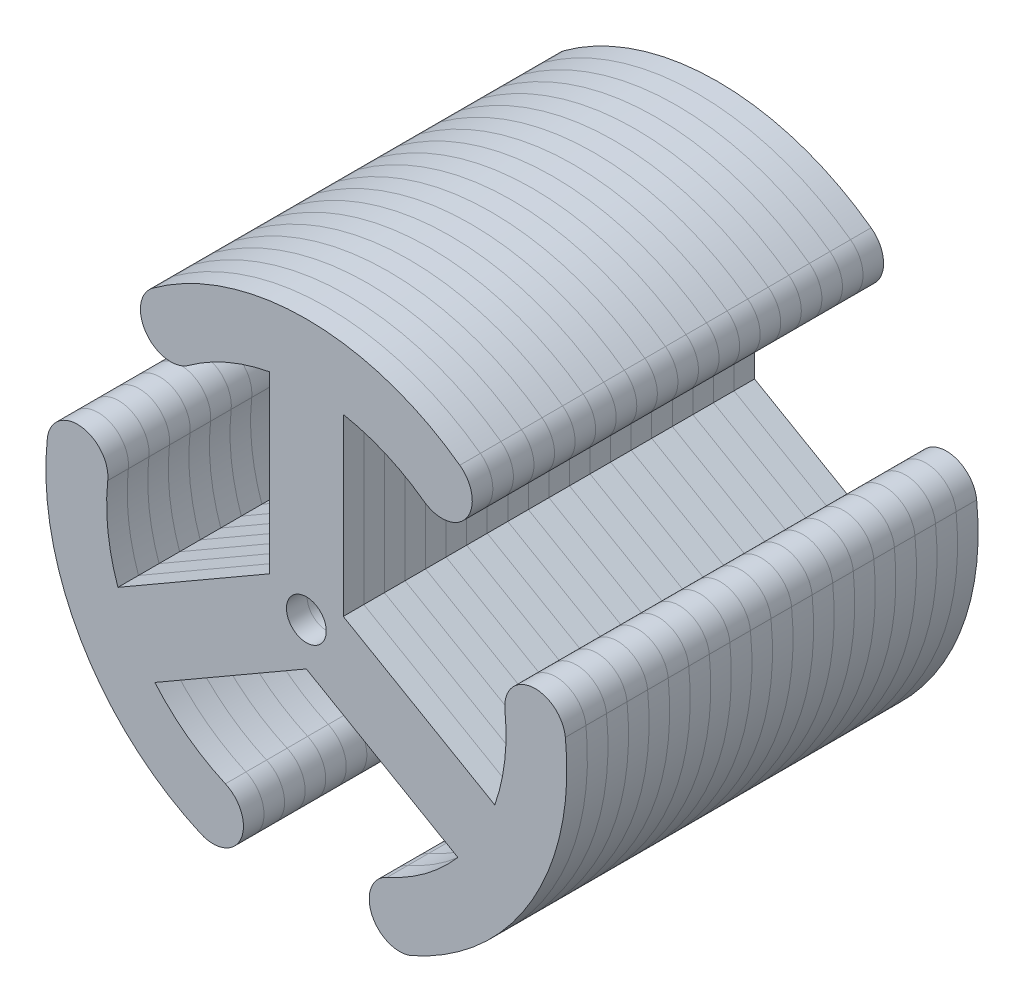
from build123d import *

# Parameters (mm, degrees)
BOSS_EXTRUDE3_DEPTH = 1.5
CIRPATTERN1_COUNT   = 3
LPATTERN1_COUNT     = 20
LPATTERN1_PITCH     = 1.5
SKETCH6_R           = 1.45
CUT_EXTRUDE1_DEPTH  = 31.5


with BuildPart() as part:
    # Sketch2 → Boss-Extrude3 (new body)
    with BuildSketch(Plane.XY):
        with BuildLine():
            ThreePointArc((-11.191746167, 15.353983774), (-11.677300028, 12.257240413), (-8.580556666, 11.771686551))
            ThreePointArc((-8.580556666, 11.771686551), (-5.778042889, 13.37208949), (-2.691924581, 14.31614819))
            Line((-2.691924581, 14.31614819), (-2.691924581, 0))
            Line((-2.691924581, 0), (2.691924581, 0))
            Line((2.691924581, 0), (2.691924581, 14.31614819))
            ThreePointArc((2.691924581, 14.31614819), (5.778042889, 13.37208949), (8.580556666, 11.771686551))
            ThreePointArc((8.580556666, 11.771686551), (11.677300028, 12.257240413), (11.191746167, 15.353983774))
            ThreePointArc((11.191746167, 15.353983774), (0, 19), (-11.191746167, 15.353983774))
        make_face()
    extrude(amount=BOSS_EXTRUDE3_DEPTH)

    # CirPattern1: part ×3 about axis
    cirpattern1_axis = Axis((0, 0, 0), (0, 0, -1))


with BuildPart() as part_1:
    add(part.part)
    for i in range(1, CIRPATTERN1_COUNT):
        add(part.part.rotate(cirpattern1_axis, i * 360 / CIRPATTERN1_COUNT))


with BuildPart() as lpattern1_1:
    # LPattern1: pattern copy
    add(part_1.part.moved(Location(Vector(0, 0, 1) * (1 * LPATTERN1_PITCH))))


with BuildPart() as lpattern1_2:
    # LPattern1: pattern copy
    add(part_1.part.moved(Location(Vector(0, 0, 1) * (2 * LPATTERN1_PITCH))))


with BuildPart() as lpattern1_3:
    # LPattern1: pattern copy
    add(part_1.part.moved(Location(Vector(0, 0, 1) * (3 * LPATTERN1_PITCH))))


with BuildPart() as lpattern1_4:
    # LPattern1: pattern copy
    add(part_1.part.moved(Location(Vector(0, 0, 1) * (4 * LPATTERN1_PITCH))))


with BuildPart() as lpattern1_5:
    # LPattern1: pattern copy
    add(part_1.part.moved(Location(Vector(0, 0, 1) * (5 * LPATTERN1_PITCH))))


with BuildPart() as lpattern1_6:
    # LPattern1: pattern copy
    add(part_1.part.moved(Location(Vector(0, 0, 1) * (6 * LPATTERN1_PITCH))))


with BuildPart() as lpattern1_7:
    # LPattern1: pattern copy
    add(part_1.part.moved(Location(Vector(0, 0, 1) * (7 * LPATTERN1_PITCH))))


with BuildPart() as lpattern1_8:
    # LPattern1: pattern copy
    add(part_1.part.moved(Location(Vector(0, 0, 1) * (8 * LPATTERN1_PITCH))))


with BuildPart() as lpattern1_9:
    # LPattern1: pattern copy
    add(part_1.part.moved(Location(Vector(0, 0, 1) * (9 * LPATTERN1_PITCH))))


with BuildPart() as lpattern1_10:
    # LPattern1: pattern copy
    add(part_1.part.moved(Location(Vector(0, 0, 1) * (10 * LPATTERN1_PITCH))))


with BuildPart() as lpattern1_11:
    # LPattern1: pattern copy
    add(part_1.part.moved(Location(Vector(0, 0, 1) * (11 * LPATTERN1_PITCH))))


with BuildPart() as lpattern1_12:
    # LPattern1: pattern copy
    add(part_1.part.moved(Location(Vector(0, 0, 1) * (12 * LPATTERN1_PITCH))))


with BuildPart() as lpattern1_13:
    # LPattern1: pattern copy
    add(part_1.part.moved(Location(Vector(0, 0, 1) * (13 * LPATTERN1_PITCH))))


with BuildPart() as lpattern1_14:
    # LPattern1: pattern copy
    add(part_1.part.moved(Location(Vector(0, 0, 1) * (14 * LPATTERN1_PITCH))))


with BuildPart() as lpattern1_15:
    # LPattern1: pattern copy
    add(part_1.part.moved(Location(Vector(0, 0, 1) * (15 * LPATTERN1_PITCH))))


with BuildPart() as lpattern1_16:
    # LPattern1: pattern copy
    add(part_1.part.moved(Location(Vector(0, 0, 1) * (16 * LPATTERN1_PITCH))))


with BuildPart() as lpattern1_17:
    # LPattern1: pattern copy
    add(part_1.part.moved(Location(Vector(0, 0, 1) * (17 * LPATTERN1_PITCH))))


with BuildPart() as lpattern1_18:
    # LPattern1: pattern copy
    add(part_1.part.moved(Location(Vector(0, 0, 1) * (18 * LPATTERN1_PITCH))))


with BuildPart() as lpattern1_19:
    # LPattern1: pattern copy
    add(part_1.part.moved(Location(Vector(0, 0, 1) * (19 * LPATTERN1_PITCH))))


with BuildPart() as cut_extrude1_tool:
    # Sketch6 → Cut-Extrude1 (new body)
    with BuildSketch(Plane.XY.offset(30)):
        Circle(SKETCH6_R)
    extrude(amount=-CUT_EXTRUDE1_DEPTH)


with BuildPart() as part_2:
    add(part_1.part)

    # Cut-Extrude1: cut by cut_extrude1_tool
    add(cut_extrude1_tool.part, mode=Mode.SUBTRACT)


with BuildPart() as lpattern1_1_1:
    add(lpattern1_1.part)

    # Cut-Extrude1: cut by cut_extrude1_tool
    add(cut_extrude1_tool.part, mode=Mode.SUBTRACT)


with BuildPart() as lpattern1_2_1:
    add(lpattern1_2.part)

    # Cut-Extrude1: cut by cut_extrude1_tool
    add(cut_extrude1_tool.part, mode=Mode.SUBTRACT)


with BuildPart() as lpattern1_3_1:
    add(lpattern1_3.part)

    # Cut-Extrude1: cut by cut_extrude1_tool
    add(cut_extrude1_tool.part, mode=Mode.SUBTRACT)


with BuildPart() as lpattern1_4_1:
    add(lpattern1_4.part)

    # Cut-Extrude1: cut by cut_extrude1_tool
    add(cut_extrude1_tool.part, mode=Mode.SUBTRACT)


with BuildPart() as lpattern1_5_1:
    add(lpattern1_5.part)

    # Cut-Extrude1: cut by cut_extrude1_tool
    add(cut_extrude1_tool.part, mode=Mode.SUBTRACT)


with BuildPart() as lpattern1_6_1:
    add(lpattern1_6.part)

    # Cut-Extrude1: cut by cut_extrude1_tool
    add(cut_extrude1_tool.part, mode=Mode.SUBTRACT)


with BuildPart() as lpattern1_7_1:
    add(lpattern1_7.part)

    # Cut-Extrude1: cut by cut_extrude1_tool
    add(cut_extrude1_tool.part, mode=Mode.SUBTRACT)


with BuildPart() as lpattern1_8_1:
    add(lpattern1_8.part)

    # Cut-Extrude1: cut by cut_extrude1_tool
    add(cut_extrude1_tool.part, mode=Mode.SUBTRACT)


with BuildPart() as lpattern1_9_1:
    add(lpattern1_9.part)

    # Cut-Extrude1: cut by cut_extrude1_tool
    add(cut_extrude1_tool.part, mode=Mode.SUBTRACT)


with BuildPart() as lpattern1_10_1:
    add(lpattern1_10.part)

    # Cut-Extrude1: cut by cut_extrude1_tool
    add(cut_extrude1_tool.part, mode=Mode.SUBTRACT)


with BuildPart() as lpattern1_11_1:
    add(lpattern1_11.part)

    # Cut-Extrude1: cut by cut_extrude1_tool
    add(cut_extrude1_tool.part, mode=Mode.SUBTRACT)


with BuildPart() as lpattern1_12_1:
    add(lpattern1_12.part)

    # Cut-Extrude1: cut by cut_extrude1_tool
    add(cut_extrude1_tool.part, mode=Mode.SUBTRACT)


with BuildPart() as lpattern1_13_1:
    add(lpattern1_13.part)

    # Cut-Extrude1: cut by cut_extrude1_tool
    add(cut_extrude1_tool.part, mode=Mode.SUBTRACT)


with BuildPart() as lpattern1_14_1:
    add(lpattern1_14.part)

    # Cut-Extrude1: cut by cut_extrude1_tool
    add(cut_extrude1_tool.part, mode=Mode.SUBTRACT)


with BuildPart() as lpattern1_15_1:
    add(lpattern1_15.part)

    # Cut-Extrude1: cut by cut_extrude1_tool
    add(cut_extrude1_tool.part, mode=Mode.SUBTRACT)


with BuildPart() as lpattern1_16_1:
    add(lpattern1_16.part)

    # Cut-Extrude1: cut by cut_extrude1_tool
    add(cut_extrude1_tool.part, mode=Mode.SUBTRACT)


with BuildPart() as lpattern1_17_1:
    add(lpattern1_17.part)

    # Cut-Extrude1: cut by cut_extrude1_tool
    add(cut_extrude1_tool.part, mode=Mode.SUBTRACT)


with BuildPart() as lpattern1_18_1:
    add(lpattern1_18.part)

    # Cut-Extrude1: cut by cut_extrude1_tool
    add(cut_extrude1_tool.part, mode=Mode.SUBTRACT)


with BuildPart() as lpattern1_19_1:
    add(lpattern1_19.part)

    # Cut-Extrude1: cut by cut_extrude1_tool
    add(cut_extrude1_tool.part, mode=Mode.SUBTRACT)


solid = Compound([part_2.part, lpattern1_1_1.part, lpattern1_2_1.part, lpattern1_3_1.part, lpattern1_4_1.part, lpattern1_5_1.part, lpattern1_6_1.part, lpattern1_7_1.part, lpattern1_8_1.part, lpattern1_9_1.part, lpattern1_10_1.part, lpattern1_11_1.part, lpattern1_12_1.part, lpattern1_13_1.part, lpattern1_14_1.part, lpattern1_15_1.part, lpattern1_16_1.part, lpattern1_17_1.part, lpattern1_18_1.part, lpattern1_19_1.part])
